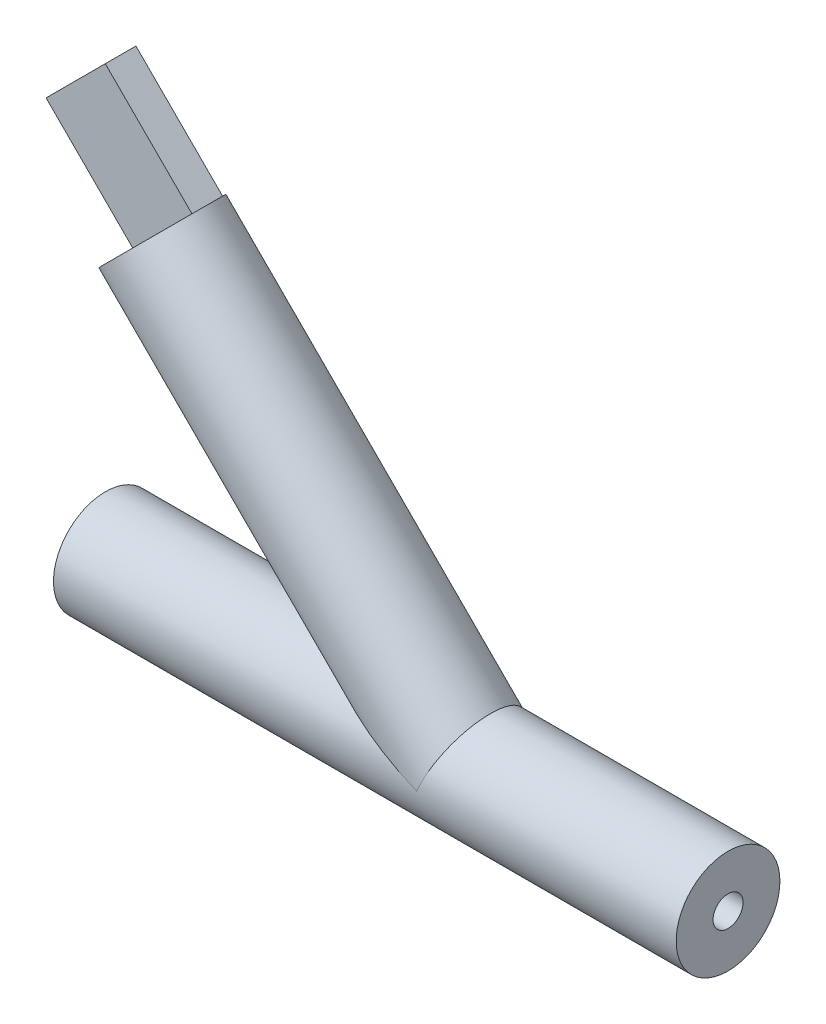
from build123d import *

# Parameters (mm, degrees)
SKETCH1_R           = 12.7
BOSS_EXTRUDE1_DEPTH = 152.4
SKETCH7_R           = 12.7
BOSS_EXTRUDE3_DEPTH = 106
SKETCH10_W          = 7.5
SKETCH10_H          = 20.497804761
BOSS_EXTRUDE8_DEPTH = 30
SKETCH11_R          = 3.675
CUT_EXTRUDE2_DEPTH  = 152.4


with BuildPart() as part:
    # Sketch1 → Boss-Extrude1 (new body)
    with BuildSketch(Plane(origin=(0, 0, 0), x_dir=(0, 0, -1), z_dir=(1, 0, 0))):
        Circle(SKETCH1_R)
    extrude(amount=BOSS_EXTRUDE1_DEPTH)

    # Sketch7 → Boss-Extrude3 (add)
    with BuildSketch(Plane(origin=(44.45, -44.45, 0), x_dir=(0.7071067811865464, 0.7071067811865488, 0), z_dir=(-0.7071067811865488, 0.7071067811865464, 0))):
        with Locations((62.861792847, 0)):
            Circle(SKETCH7_R)
    extrude(amount=BOSS_EXTRUDE3_DEPTH)

    # Sketch10 → Boss-Extrude8 (add)
    with BuildSketch(Plane(origin=(-30.503318806, 30.503318806, 0), x_dir=(0, 0, 1), z_dir=(-0.7071067811865487, 0.7071067811865465, 0))):
        with Locations((-3.75, 62.861792848)):
            Rectangle(SKETCH10_W, SKETCH10_H)
    extrude(amount=BOSS_EXTRUDE8_DEPTH)

    # Sketch11 → Cut-Extrude2 (cut)
    with BuildSketch(Plane(origin=(152.4, 0, 0), x_dir=(0, 0, -1), z_dir=(1, 0, 0))):
        Circle(SKETCH11_R)
    extrude(amount=-CUT_EXTRUDE2_DEPTH, mode=Mode.SUBTRACT)


solid = part.part
